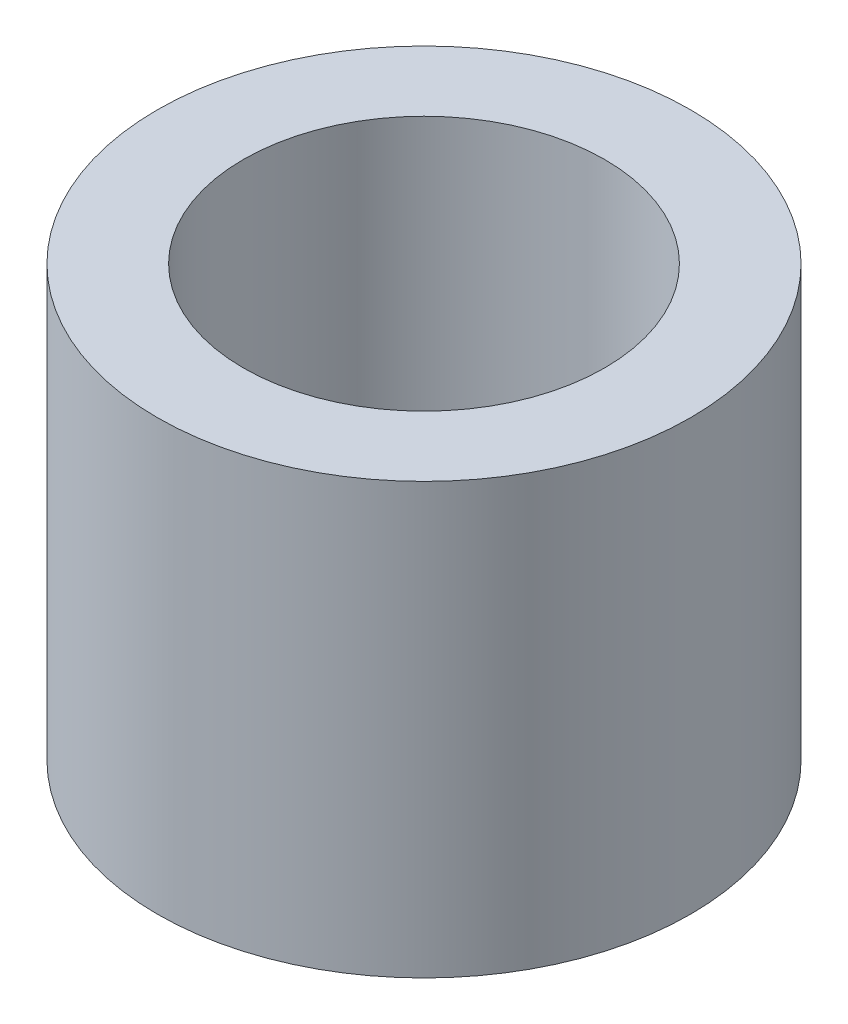
from build123d import *

# Parameters (mm, degrees)
SKETCH1_R           = 3.1
SKETCH1_R_2         = 2.1
BOSS_EXTRUDE1_DEPTH = 5


with BuildPart() as part:
    # Sketch1 → Boss-Extrude1 (new body)
    with BuildSketch(Plane(origin=(0, 0, 0), x_dir=(1, 0, 0), z_dir=(0, 1, 0))):
        Circle(SKETCH1_R)
        Circle(SKETCH1_R_2, mode=Mode.SUBTRACT)
    extrude(amount=BOSS_EXTRUDE1_DEPTH)


solid = part.part
